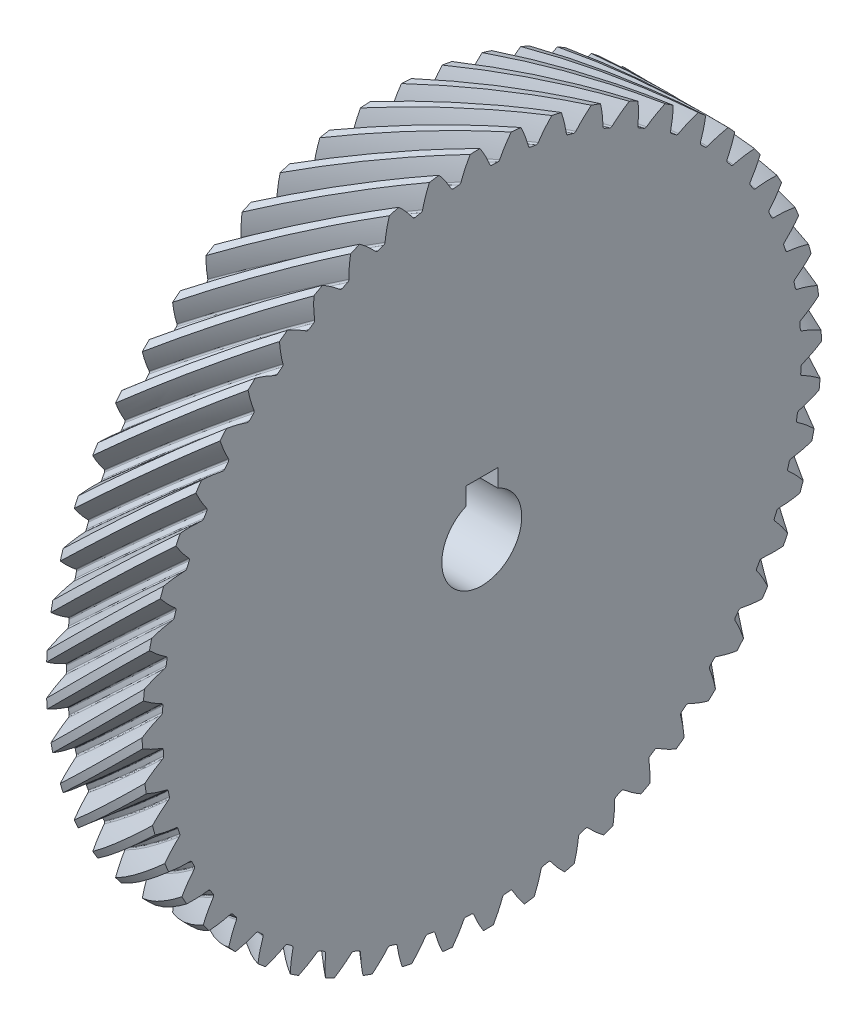
from build123d import *

# Parameters (mm, degrees)
BASPROSKE_W            = 12
BASPROSKE_H            = 42.490746699
TOOTHCUTLH_PITCH       = 266.977235353
TOOTHCUTLH_HEIGHT      = 12
TOOTHCUTLH_RADIUS      = 42.490746699
TOOTHCUTLH_START_ANGLE = -90
TEETHCUTSLH_COUNT      = 52
TEETHCUTSLH_ANGLE      = 353.076923077
BORSKE_R               = 5
BORE_DEPTH             = 62.5000025
KEYSKE_W               = 4
KEYSKE_H               = 6.8
KEYWAY_DEPTH           = 62.5000025


with BuildPart() as part:
    # BasProSke → Base-Revolve (revolve)
    with BuildSketch(Plane(origin=(0, 0, 0), x_dir=(1, 0, 0), z_dir=(0, 1, 0)), mode=Mode.PRIVATE) as base_revolve_sk:
        with Locations((6, 21.24537335)):
            Rectangle(BASPROSKE_W, BASPROSKE_H)
    revolve(base_revolve_sk.sketch.rotate(Axis((-10, 0, 0), (1, 0, 0)), 180), axis=Axis((-10, 0, 0), (1, 0, 0)))

    # ToothCutLH: sweep along a helix
    with BuildLine() as toothcutlh_path:
        add(Helix(TOOTHCUTLH_PITCH, TOOTHCUTLH_HEIGHT, TOOTHCUTLH_RADIUS, center=(0, 0, 0), direction=(1, 0, 0), lefthand=True, mode=Mode.PRIVATE).rotate(Axis((0, 0, 0), (1, 0, 0)), TOOTHCUTLH_START_ANGLE))
    # TooCutSkeRH<3> → ToothCutLH (sweep, cut)
    with BuildSketch(Plane(origin=(0, 0, 0), x_dir=(0, 0, -1), z_dir=(1, 0, 0))):
        with BuildLine():
            ThreePointArc((0.359200206, 39.957882222), (0, 39.959496699), (-0.359200206, 39.957882222))
            ThreePointArc((-0.359200206, 39.957882222), (-0.513229487, 40.001971276), (-0.618446527, 40.122794447))
            ThreePointArc((-0.618446527, 40.122794447), (-1.635060904, 41.978816341), (-2.90889103, 43.668691743))
            ThreePointArc((-2.90889103, 43.668691743), (0, 43.7654691), (2.90889103, 43.668691743))
            ThreePointArc((2.90889103, 43.668691743), (1.635060904, 41.978816341), (0.618446527, 40.122794447))
            ThreePointArc((0.618446527, 40.122794447), (0.513229487, 40.001971276), (0.359200206, 39.957882222))
        make_face()
    toothcutlh = sweep(path=toothcutlh_path.line, is_frenet=True, mode=Mode.SUBTRACT)

    # TeethCutsLH: ToothCutLH ×52 about axis
    teethcutslh_axis = Axis((-10, 0, 0), (1, 0, 0))
    for i in range(1, TEETHCUTSLH_COUNT):
        add(toothcutlh.rotate(teethcutslh_axis, i * TEETHCUTSLH_ANGLE / (TEETHCUTSLH_COUNT - 1)), mode=Mode.SUBTRACT)

    # BorSke → Bore (cut, symmetric)
    with BuildSketch(Plane(origin=(0, 0, 0), x_dir=(0, 0, -1), z_dir=(1, 0, 0))):
        with Locations(Location((0, 0, 0), (0, 0, 180))):
            Circle(BORSKE_R)
    extrude(amount=BORE_DEPTH, both=True, mode=Mode.SUBTRACT)

    # KeySke → Keyway (cut, symmetric)
    with BuildSketch(Plane(origin=(0, 0, 0), x_dir=(0, 0, -1), z_dir=(1, 0, 0))):
        with Locations((0, 3.4)):
            Rectangle(KEYSKE_W, KEYSKE_H)
    extrude(amount=KEYWAY_DEPTH, both=True, mode=Mode.SUBTRACT)


solid = part.part
